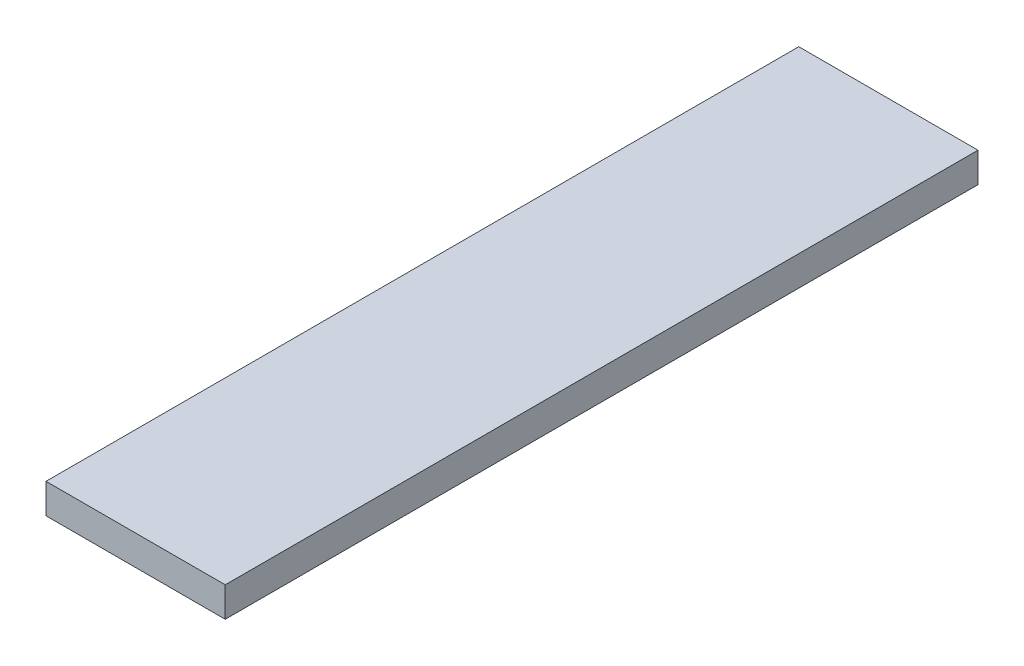
from build123d import *

# Parameters (mm, degrees)
SKETCH1_W           = 30
SKETCH1_H           = 126
BOSS_EXTRUDE1_DEPTH = 5


with BuildPart() as part:
    # Sketch1 → Boss-Extrude1 (new body)
    with BuildSketch(Plane(origin=(0, 0, 0), x_dir=(1, 0, 0), z_dir=(0, 1, 0))):
        with Locations((-65.650887574, -32.349112426)):
            Rectangle(SKETCH1_W, SKETCH1_H)
    extrude(amount=BOSS_EXTRUDE1_DEPTH)


solid = part.part
